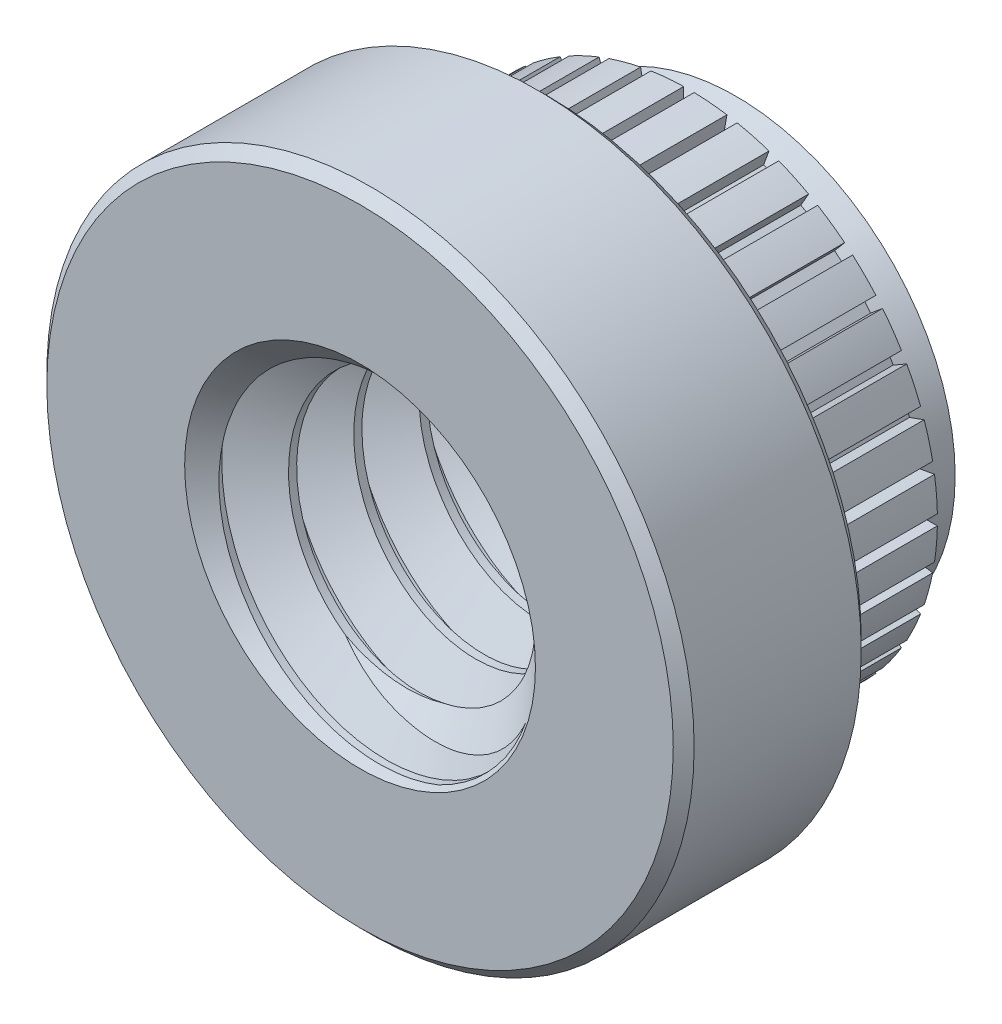
from build123d import *

# Parameters (mm, degrees)
SKETCH1_R               = 3.937
EXTRUDE1_DEPTH          = 2.286
SKETCH2_R               = 3.0226
EXTRUDE2_DEPTH          = 2.286
SKETCH3_W               = 0.127
SKETCH3_H               = 1.1049
CUT_EXTRUDE_THIN1_DEPTH = 2.286
CIRPATTERN1_COUNT       = 36
SKETCH5_OUTSIDE_W       = 12.698
SKETCH5_OUTSIDE_H       = 12.698
SKETCH5_OUTSIDE_R       = 2.667
CUT_EXTRUDE1_DEPTH      = 0.5715
CUT_EXTRUDE1_DRAFT      = 20
CHAMFER2_SIZE           = 0.127
SKETCH7_R               = 2.0828
CUT_EXTRUDE3_DEPTH      = 8.204382139
SWEEP1_PITCH            = 0.79375
SKETCH10_R              = 3.937
CUT_EXTRUDE4_DEPTH      = 8.664079519
SKETCH11_R              = 2.667
CUT_EXTRUDE5_DEPTH      = 8.204382202


with BuildPart() as part:
    # Sketch1 → Extrude1 (new body)
    with BuildSketch(Plane.XY):
        Circle(SKETCH1_R)
    extrude(amount=-EXTRUDE1_DEPTH)

    # Sketch2 → Extrude2 (add)
    with BuildSketch(Plane(origin=(0, 0, -2.286), x_dir=(-1, 0, 0), z_dir=(0, 0, -1))):
        with Locations(Location((0, 0, 0), (0, 0, 180))):
            Circle(SKETCH2_R)
    extrude(amount=EXTRUDE2_DEPTH)

    # Sketch3 → Cut-Extrude-Thin1 (cut)
    with BuildSketch(Plane(origin=(0, 0, -4.572), x_dir=(-1, 0, 0), z_dir=(0, 0, -1))):
        with Locations((0, 3.38455)):
            Rectangle(SKETCH3_W, SKETCH3_H)
    cut_extrude_thin1 = extrude(amount=-CUT_EXTRUDE_THIN1_DEPTH, mode=Mode.SUBTRACT)

    # CirPattern1: Cut-Extrude-Thin1 ×36 about axis
    cirpattern1_axis = Axis((0, 0, 0), (0, 0, 1))
    for i in range(1, CIRPATTERN1_COUNT):
        add(cut_extrude_thin1.rotate(cirpattern1_axis, i * 360 / CIRPATTERN1_COUNT), mode=Mode.SUBTRACT)


with BuildPart() as cut_extrude1_tool:
    # Sketch5 outside → Cut-Extrude1 (with draft: the straight prism first)
    with BuildSketch(Plane(origin=(0, 0, -4.572), x_dir=(-1, 0, 0), z_dir=(0, 0, -1))):
        Rectangle(SKETCH5_OUTSIDE_W, SKETCH5_OUTSIDE_H)
        Circle(SKETCH5_OUTSIDE_R, mode=Mode.SUBTRACT)
    extrude(amount=-CUT_EXTRUDE1_DEPTH)
    # Cut-Extrude1: the draft: its side faces are tilted about the plane it starts from
    cut_extrude1_sides = [cut_extrude1_tool.faces().sort_by_distance(p)[0] for p in [
        (0, -6.349, -4.28625),
        (-6.349, 0, -4.28625),
        (0, 6.349, -4.28625),
        (6.349, 0, -4.28625),
        (2.667, 0, -4.28625),
    ]]
    draft(cut_extrude1_sides, Plane(origin=(0, 0, -4.572), x_dir=(-1, 0, 0), z_dir=(0, 0, -1)), CUT_EXTRUDE1_DRAFT)


with BuildPart() as part_1:
    add(part.part)

    # Cut-Extrude1: cut by cut_extrude1_tool
    add(cut_extrude1_tool.part, mode=Mode.SUBTRACT)

    # Chamfer2
    chamfer2_edges = [part_1.edges().sort_by_distance(p)[0] for p in [
        (-3.937, 0, 0),
        (-3.937, 0, -2.286),
    ]]
    chamfer(chamfer2_edges, length=CHAMFER2_SIZE)

    # Sketch7 → Cut-Extrude3 (cut, through all)
    with BuildSketch(Plane.XY):
        Circle(SKETCH7_R)
    extrude(amount=-CUT_EXTRUDE3_DEPTH, mode=Mode.SUBTRACT)

    # Sweep1: the profile of Sketch9 profile screwed along a right-hand helix of 9.76 turns, 6 arcs to a turn; built about Z, then put on its axis
    sweep1_z = Axis((0, 0, 0), (0, 0, 1))
    sweep1_corners = [(2.0831, 0, -0.694704455), (1.567244252, 0, -0.396875), (1.567244252, 0, -0.29765625), (2.0831, 0, 0.000173205)]
    with BuildLine(mode=Mode.PRIVATE) as sweep1_profile:
        Line(sweep1_corners[0], sweep1_corners[1])
        Line(sweep1_corners[1], sweep1_corners[2])
        Line(sweep1_corners[2], sweep1_corners[3])
        Line(sweep1_corners[3], sweep1_corners[0])
    sweep1_cap = Face(sweep1_profile.wire())
    sweep1_turn_angles = [0, 30, 60, 90, 120, 150, 180, 210, 240, 270, 300, 330, 360]
    sweep1_turn_weights = [1, 0.8660254037844387, 1, 0.8660254037844387, 1, 0.8660254037844387, 1, 0.8660254037844387, 1, 0.8660254037844387, 1, 0.8660254037844387, 1]
    sweep1_turn_rails = [Edge.make_bspline([Vector(p[0], p[1], 0).rotate(sweep1_z, sweep1_turn_angles[k]) / sweep1_turn_weights[k] + Vector(0, 0, p[2] + SWEEP1_PITCH * sweep1_turn_angles[k] / 360) for k in range(13)], [0, 0, 0, 1, 1, 2, 2, 3, 3, 4, 4, 5, 5, 6, 6, 6], 2, sweep1_turn_weights) for p in sweep1_corners]
    sweep1_turn_sides = [Face.make_surface_from_curves(sweep1_turn_rails[p[0]], sweep1_turn_rails[p[1]]) for p in [(0, 1), (1, 2), (2, 3), (3, 0)]]
    sweep1_last_angles = [3240, 3270, 3300, 3330, 3360, 3390, 3420, 3450, 3480, 3496.8, 3513.6]
    sweep1_last_weights = [1, 0.8660254037844387, 1, 0.8660254037844387, 1, 0.8660254037844387, 1, 0.8660254037844387, 1, 0.9573194975320675, 1]
    sweep1_last_rails = [Edge.make_bspline([Vector(p[0], p[1], 0).rotate(sweep1_z, sweep1_last_angles[k]) / sweep1_last_weights[k] + Vector(0, 0, p[2] + SWEEP1_PITCH * sweep1_last_angles[k] / 360) for k in range(11)], [0, 0, 0, 1, 1, 2, 2, 3, 3, 4, 4, 5, 5, 5], 2, sweep1_last_weights) for p in sweep1_corners]
    sweep1_last_sides = [Face.make_surface_from_curves(sweep1_last_rails[p[0]], sweep1_last_rails[p[1]]) for p in [(0, 1), (1, 2), (2, 3), (3, 0)]]
    sweep1 = Plane(origin=(0, 0, -4.572), x_dir=(0, 1, 0), z_dir=(0, 0, 1)) * Solid(Shell([*[p.moved(Location((0, 0, SWEEP1_PITCH * i))) for i in range(9) for p in sweep1_turn_sides], *sweep1_last_sides, sweep1_cap, sweep1_cap.rotate(sweep1_z, 3513.6).moved(Location((0, 0, SWEEP1_PITCH * 3513.6 / 360)))]))
    add(sweep1)

    # Sketch10 → Cut-Extrude4 (cut, through all)
    with BuildSketch(Plane.XY):
        Circle(SKETCH10_R)
    extrude(amount=CUT_EXTRUDE4_DEPTH, mode=Mode.SUBTRACT)

    # Sketch11 → Cut-Extrude5 (cut, through all)
    with BuildSketch(Plane(origin=(0, 0, -4.572), x_dir=(-1, 0, 0), z_dir=(0, 0, -1))):
        Circle(SKETCH11_R)
    extrude(amount=CUT_EXTRUDE5_DEPTH, mode=Mode.SUBTRACT)

    # Cut-Extrude6 cone 1 section (through the dimple's axis) → Cut-Extrude6 (revolve, cut)
    with BuildSketch(Plane(origin=(0, 0, 0), x_dir=(0, -1, 0), z_dir=(1, 0, 0))):
        Polygon((0, 0), (2.1336, 0), (0, 2.1336), align=None)
    revolve(axis=Axis((0, 0, 0), (0, 0, -1)), mode=Mode.SUBTRACT)

    # Cut-Extrude7 cone 1 section (through the dimple's axis) → Cut-Extrude7 (revolve, cut)
    with BuildSketch(Plane(origin=(0, 0, -4.572), x_dir=(0, 1, 0), z_dir=(1, 0, 0))):
        Polygon((0, 0), (2.1336, 0), (0, 2.1336), align=None)
    revolve(axis=Axis((0, 0, -4.572), (0, 0, 1)), mode=Mode.SUBTRACT)


solid = part_1.part
